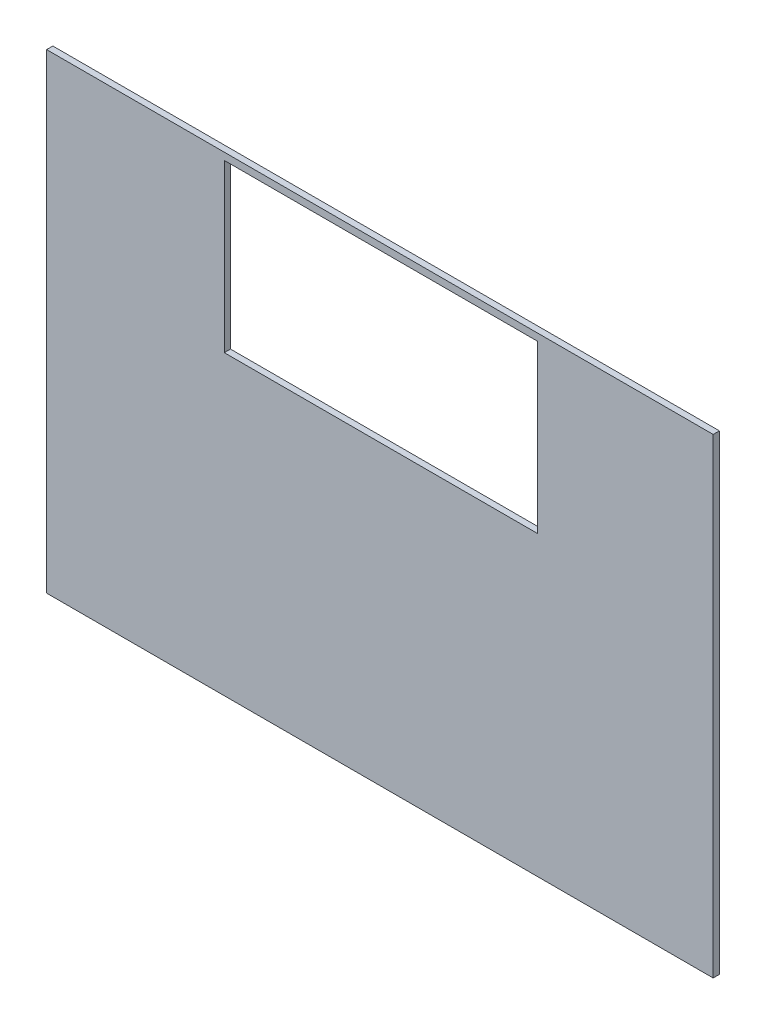
from build123d import *

# Parameters (mm, degrees)
SKETCH1_W           = 681.08
SKETCH1_H           = 481.00261168
BOSS_EXTRUDE1_DEPTH = 6.35
SKETCH2_W           = 319.846223413
SKETCH2_H           = 170.113551909
CUT_EXTRUDE1_DEPTH  = 10


with BuildPart() as part:
    # Sketch1 → Boss-Extrude1 (new body)
    with BuildSketch(Plane.XY):
        with Locations((340.54, -240.50130584)):
            Rectangle(SKETCH1_W, SKETCH1_H)
    extrude(amount=BOSS_EXTRUDE1_DEPTH)

    # Sketch2 → Cut-Extrude1 (cut)
    with BuildSketch(Plane(origin=(0, 0, 0), x_dir=(-1, 0, 0), z_dir=(0, 0, -1))):
        with Locations((-341.464956121, -92.352129436)):
            Rectangle(SKETCH2_W, SKETCH2_H)
    extrude(amount=-CUT_EXTRUDE1_DEPTH, mode=Mode.SUBTRACT)


solid = part.part
